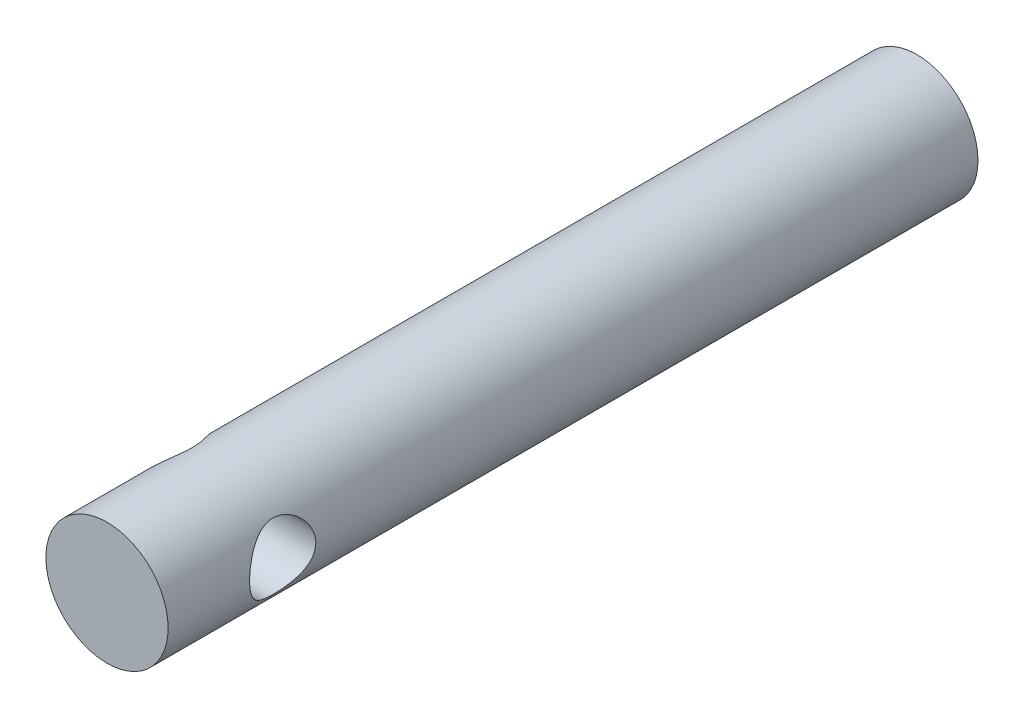
from build123d import *

# Parameters (mm, degrees)
SKETCH1_R           = 4
BOSS_EXTRUDE1_DEPTH = 53.002621
SKETCH2_R           = 2.165
CUT_EXTRUDE1_DEPTH  = 9
SKETCH4_R           = 3.5
CUT_EXTRUDE2_DEPTH  = 54.303638198


with BuildPart() as part:
    # Sketch1 → Boss-Extrude1 (new body)
    with BuildSketch(Plane.XY):
        Circle(SKETCH1_R)
    extrude(amount=BOSS_EXTRUDE1_DEPTH)

    # Sketch2 → Cut-Extrude1 (cut, symmetric)
    with BuildSketch(Plane(origin=(0, 0, 0), x_dir=(0, 0, -1), z_dir=(1, 0, 0))):
        with Locations((-45.502621, 0)):
            Circle(SKETCH2_R)
    extrude(amount=CUT_EXTRUDE1_DEPTH, both=True, mode=Mode.SUBTRACT)

    # Sketch4 → Cut-Extrude2 (cut, through all)
    with BuildSketch(Plane(origin=(0, 0, 0), x_dir=(0, 0, -1), z_dir=(1, 0, 0))):
        with Locations((-45.502621, 0)):
            Circle(SKETCH4_R)
    extrude(amount=-CUT_EXTRUDE2_DEPTH, mode=Mode.SUBTRACT)


solid = part.part
